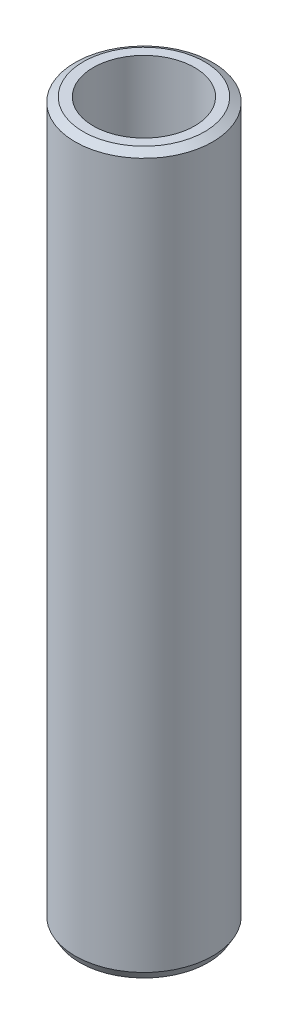
from build123d import *
from OCP.BRepFilletAPI import BRepFilletAPI_MakeChamfer

# Parameters (mm, degrees)
SKETCH1_R           = 57.5
BOSS_EXTRUDE1_DEPTH = 600
SKETCH2_R           = 42.357259812
CUT_EXTRUDE1_DEPTH  = 606.485342515
CHAMFER1_SIZE       = 3.93119278
CHAMFER1_SIZE2      = 6.809025629


with BuildPart() as part:
    # Sketch1 → Boss-Extrude1 (new body)
    with BuildSketch(Plane(origin=(0, 0, 0), x_dir=(1, 0, 0), z_dir=(0, 1, 0))):
        Circle(SKETCH1_R)
    extrude(amount=BOSS_EXTRUDE1_DEPTH)

    # Sketch2 → Cut-Extrude1 (cut, through all)
    with BuildSketch(Plane(origin=(0, 0, 0), x_dir=(1, 0, 0), z_dir=(0, 1, 0))):
        Circle(SKETCH2_R)
    extrude(amount=CUT_EXTRUDE1_DEPTH, mode=Mode.SUBTRACT)

    # Chamfer1: one chamfer whose edges measure the first distance from different faces: ONE call of the kernel's chamfer builder (chamfer() names one face for all edges)
    chamfer1_edges_1 = [part.edges().sort_by_distance(p)[0] for p in [
        (-57.5, 600, 0),
    ]]
    chamfer1_side_1 = [part.faces().sort_by_distance(p)[0] for p in [
        (-57.5, 300, 0),
    ]]
    chamfer1_edges_2 = [part.edges().sort_by_distance(p)[0] for p in [
        (-57.5, 0, 0),
    ]]
    chamfer1_side_2 = [part.faces().sort_by_distance(p)[0] for p in [
        (-55.873654403, 0, 0),
    ]]
    chamfer1 = BRepFilletAPI_MakeChamfer(part.part.solid().wrapped)
    for e in chamfer1_edges_1:
        chamfer1.Add(CHAMFER1_SIZE, CHAMFER1_SIZE2, e.wrapped, chamfer1_side_1[0].wrapped)  # the first distance lies on this face
    for e in chamfer1_edges_2:
        chamfer1.Add(CHAMFER1_SIZE, CHAMFER1_SIZE2, e.wrapped, chamfer1_side_2[0].wrapped)  # the first distance lies on this face
    add(Compound.cast(chamfer1.Shape()), mode=Mode.REPLACE)


solid = part.part
